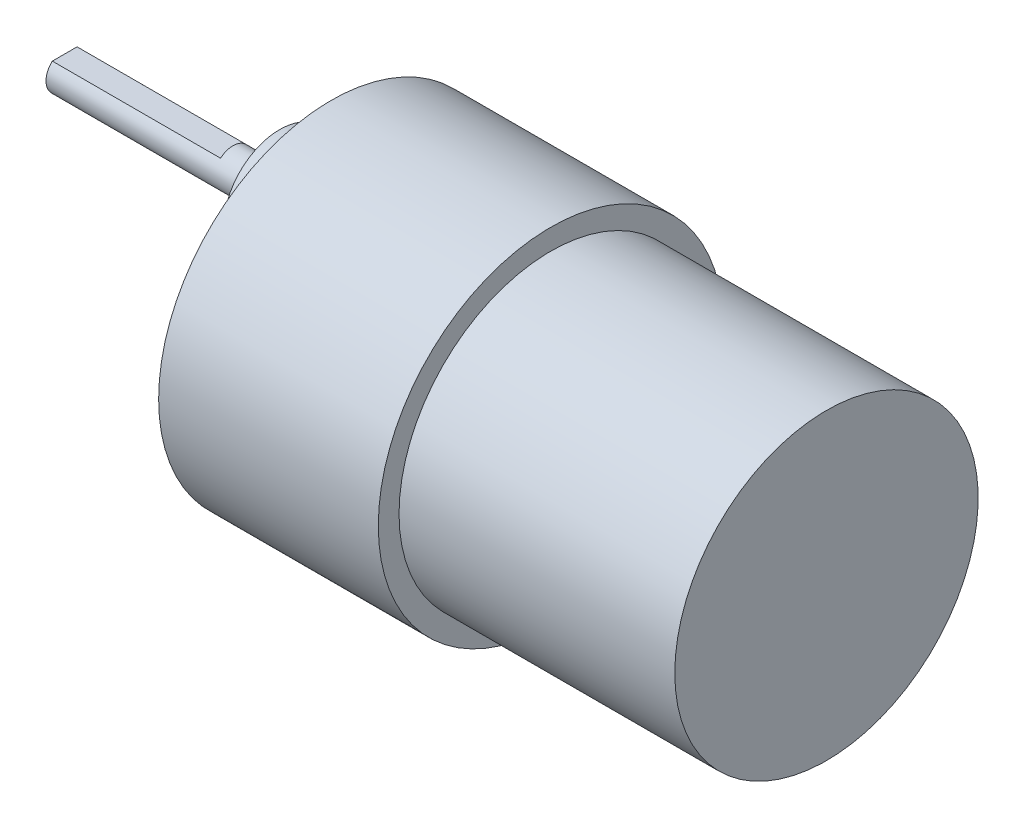
from build123d import *

# Parameters (mm, degrees)
M3_5X0_6_TAPPED_HOLE1_D     = 2.9
M3_5X0_6_TAPPED_HOLE1_DEPTH = 3.5
M3_5X0_6_TAPPED_HOLE1_TIP   = 0.871247898
SKETCH6_R                   = 6
BOSS_EXTRUDE1_DEPTH         = 5.5
SKETCH7_R                   = 2
BOSS_EXTRUDE2_DEPTH         = 23
CUT_EXTRUDE1_START          = -18
CUT_EXTRUDE1_DEPTH          = 18


with BuildPart() as part:
    # Sketch1 → Revolve1 (revolve)
    with BuildSketch(Plane.XY):
        Polygon((0, 18.45), (0, 0), (53, 0), (53, 16.23), (23.5, 16.23), (23.5, 18.45), align=None)
    revolve(axis=Axis((0, 0, 0), (1, 0, 0)))

    # M3.5x0.6 Tapped Hole1
    with Locations(Plane.ZY):
        with Locations((7.75, 13.423393759), (15.5, 0), (7.75, -13.423393759), (-7.75, -13.423393759), (-15.5, 0), (-7.75, 13.423393759)):
            Hole(M3_5X0_6_TAPPED_HOLE1_D / 2, depth=M3_5X0_6_TAPPED_HOLE1_DEPTH)
            with Locations((0, 0, -(M3_5X0_6_TAPPED_HOLE1_DEPTH + M3_5X0_6_TAPPED_HOLE1_TIP / 2))):  # 118° drill point
                Cone(0, M3_5X0_6_TAPPED_HOLE1_D / 2, M3_5X0_6_TAPPED_HOLE1_TIP, mode=Mode.SUBTRACT)

    # Sketch6 → Boss-Extrude1 (add)
    with BuildSketch(Plane.ZY):
        with Locations((0, 7)):
            Circle(SKETCH6_R)
    extrude(amount=BOSS_EXTRUDE1_DEPTH)

    # Sketch7 → Boss-Extrude2 (add)
    with BuildSketch(Plane.ZY.offset(5.5)):
        with Locations((0, 7)):
            Circle(SKETCH7_R)
    extrude(amount=BOSS_EXTRUDE2_DEPTH)

    # Sketch8 → Cut-Extrude1 (cut)
    with BuildSketch(Plane.ZY.offset(28.5).offset(CUT_EXTRUDE1_START)):
        with BuildLine():
            ThreePointArc((1.322875656, 8.5), (0, 9), (-1.322875656, 8.5))
            Line((-1.322875656, 8.5), (1.322875656, 8.5))
        make_face()
    extrude(amount=CUT_EXTRUDE1_DEPTH, mode=Mode.SUBTRACT)


solid = part.part
